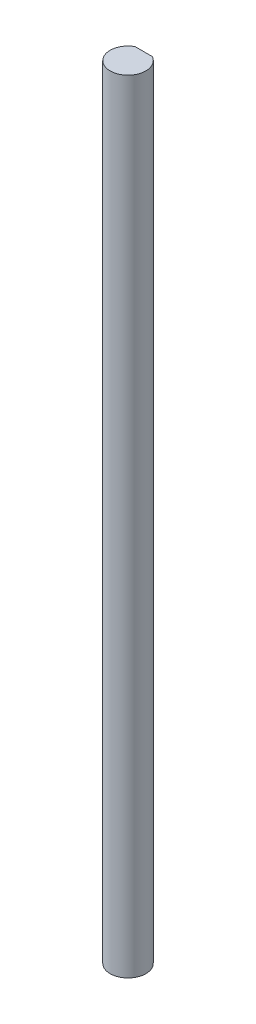
from build123d import *

# Parameters (mm, degrees)
BOSS_EXTRUDE1_DEPTH                   = 175
TAP_DRILL_FOR_M3X0_5_TAP1_D           = 2.5
TAP_DRILL_FOR_M3X0_5_TAP1_DEPTH       = 5
TAP_DRILL_FOR_M3X0_5_TAP1_CSINK_D     = 2.55
TAP_DRILL_FOR_M3X0_5_TAP1_CSINK_ANGLE = 90
TAP_DRILL_FOR_M3X0_5_TAP1_TIP         = 0.751075774


with BuildPart() as part:
    # Sketch1 → Boss-Extrude1 (new body)
    with BuildSketch(Plane(origin=(0, 0, 0), x_dir=(1, 0, 0), z_dir=(0, 1, 0))):
        with BuildLine():
            Line((-1.936491673, 3.5), (1.936491673, 3.5))
            ThreePointArc((1.936491673, 3.5), (0, -4), (-1.936491673, 3.5))
        make_face()
    extrude(amount=BOSS_EXTRUDE1_DEPTH)

    # Tap Drill for M3x0.5 Tap1
    with Locations(Plane(origin=(0, 0, -3.5), x_dir=(-1, 0, 0), z_dir=(0, 0, -1))):
        with Locations((0, 171.5)):
            CounterSinkHole(TAP_DRILL_FOR_M3X0_5_TAP1_D / 2, TAP_DRILL_FOR_M3X0_5_TAP1_CSINK_D / 2, depth=TAP_DRILL_FOR_M3X0_5_TAP1_DEPTH, counter_sink_angle=TAP_DRILL_FOR_M3X0_5_TAP1_CSINK_ANGLE)
            with Locations((0, 0, -(TAP_DRILL_FOR_M3X0_5_TAP1_DEPTH + TAP_DRILL_FOR_M3X0_5_TAP1_TIP / 2))):  # 118° drill point
                Cone(0, TAP_DRILL_FOR_M3X0_5_TAP1_D / 2, TAP_DRILL_FOR_M3X0_5_TAP1_TIP, mode=Mode.SUBTRACT)


solid = part.part
